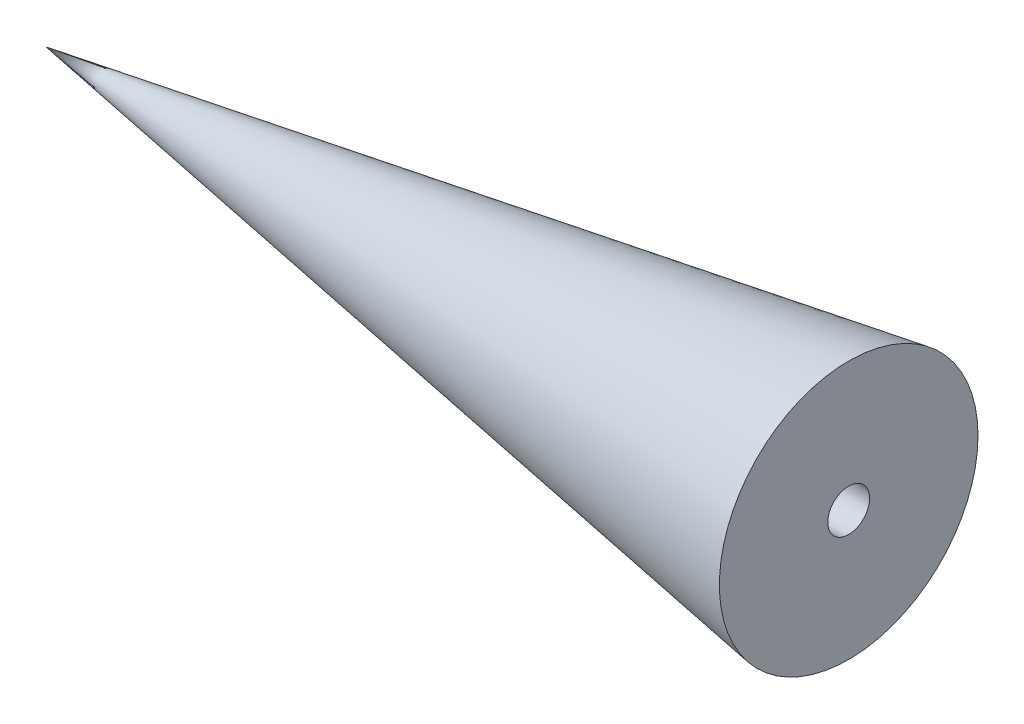
from build123d import *

# Parameters (mm, degrees)
SKETCH2_R          = 3
CUT_EXTRUDE1_DEPTH = 50


with BuildPart() as part:
    # Sketch1 → Revolve1 (revolve)
    with BuildSketch(Plane.XY):
        Polygon((0, 0), (0, 18.525), (-115, 0), align=None)
    revolve(axis=Axis((0, 0, 0), (-1, 0, 0)))

    # Sketch2 → Cut-Extrude1 (cut)
    with BuildSketch(Plane(origin=(0, 0, 0), x_dir=(0, 0, -1), z_dir=(1, 0, 0))):
        Circle(SKETCH2_R)
    extrude(amount=-CUT_EXTRUDE1_DEPTH, mode=Mode.SUBTRACT)


solid = part.part
